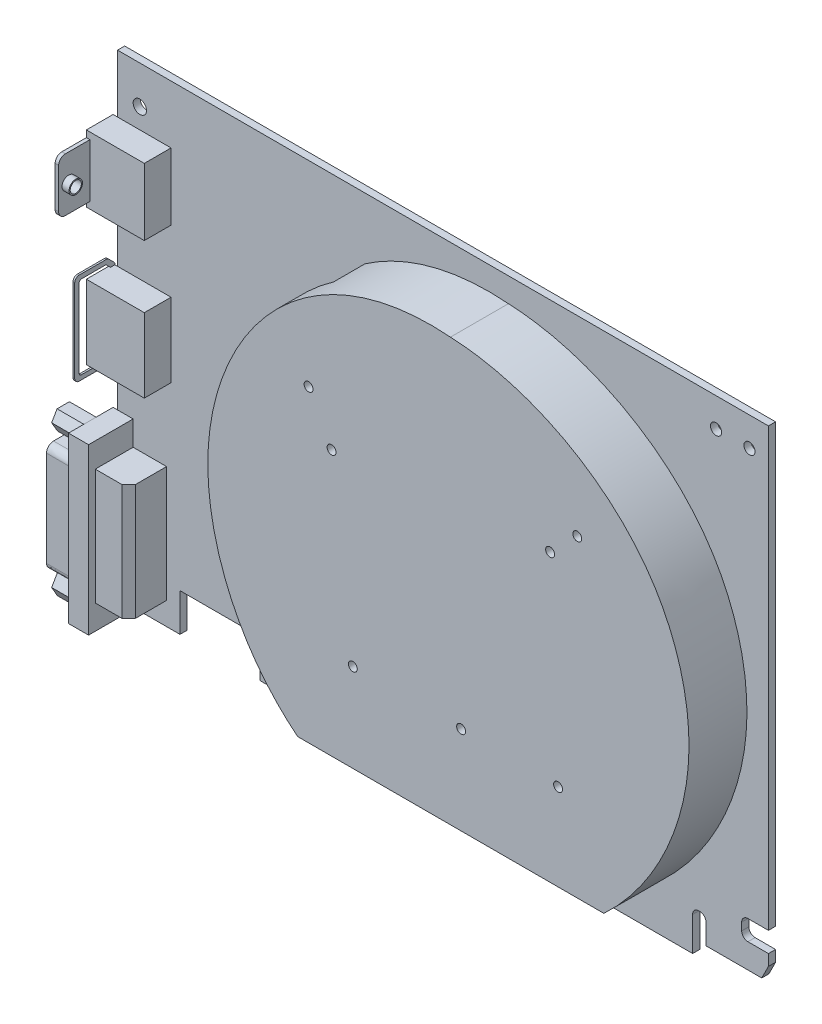
from build123d import *

# Parameters (mm, degrees)
SKETCH1_R                = 1.5
SKETCH1_R_2              = 1.25
BOSS_EXTRUDE1_DEPTH      = 1.6
SKETCH6_W                = 13
SKETCH6_H                = 15
SKETCH6_H_2              = 16.609797345
BOSS_EXTRUDE8_DEPTH      = 6
SKETCH7_R                = 1.25
BOSS_EXTRUDE9_DEPTH      = 0.79375
SKETCH8_R                = 1.5
SKETCH8_R_2              = 1.25
BOSS_EXTRUDE10_DEPTH     = 1.5875
FILLET1_R                = 0.25
BOSS_EXTRUDE11_DEPTH     = 0.396875
SKETCH10_W               = 4.5
SKETCH10_H               = 37
BOSS_EXTRUDE12_DEPTH     = 10
SKETCH11_W               = 7.5
SKETCH11_H               = 26
BOSS_EXTRUDE13_DEPTH     = 8.5
CHAMFER1_SIZE            = 1.5
BOSS_EXTRUDE14_OUTLINE_R = 1.5
BOSS_EXTRUDE14_DEPTH     = 6
SKETCH3_R                = 2
BOSS_EXTRUDE3_DEPTH      = 3.5
BOSS_EXTRUDE15_DEPTH     = 13
SKETCH15_W               = 22.221546386
SKETCH15_H               = 7
CUT_EXTRUDE1_DEPTH       = 136.345566138
CUT_EXTRUDE2_REACH       = 147.937
SKETCH16_R               = 1


# Read off the part's stored shape, not the designer's step: Boss-Extrude14
with BuildPart() as part:
    # Sketch1 → Boss-Extrude1 (new body)
    with BuildSketch(Plane.XY):
        with BuildLine():
            Line((60, 13), (60, 111))
            Line((60, 111), (-86, 111))
            Line((-86, 111), (-86, 4.5))
            Line((-86, 4.5), (-72, 4.5))
            Line((-72, 4.5), (-72, 13))
            Line((-72, 13), (-54, 13))
            Line((-54, 13), (-54, 4.5))
            Line((-54, 4.5), (-46.5, 4.5))
            Line((-46.5, 4.5), (-46.5, 11.3))
            ThreePointArc((-46.5, 11.3), (-46.002081528, 12.502081528), (-44.8, 13))
            Line((-44.8, 13), (-44.7, 13))
            ThreePointArc((-44.7, 13), (-43.497918472, 12.502081528), (-43, 11.3))
            Line((-43, 11.3), (-43, 0))
            Line((-43, 0), (-31.5, 0))
            Line((-31.5, 0), (-31.5, 7.6))
            ThreePointArc((-31.5, 7.6), (-31.089949494, 8.589949494), (-30.1, 9))
            Line((-30.1, 9), (-29.9, 9))
            ThreePointArc((-29.9, 9), (-28.910050506, 8.589949494), (-28.5, 7.6))
            Line((-28.5, 7.6), (-28.5, 0))
            Line((-28.5, 0), (43, 0))
            Line((43, 0), (43, 7.6))
            ThreePointArc((43, 7.6), (43.410050506, 8.589949494), (44.4, 9))
            Line((44.4, 9), (44.6, 9))
            ThreePointArc((44.6, 9), (45.589949494, 8.589949494), (46, 7.6))
            Line((46, 7.6), (46, 3))
            Line((46, 3), (58.5, 3))
            Line((58.5, 3), (60, 6))
            Line((60, 6), (60, 8.5))
            Line((60, 8.5), (55.4, 8.5))
            ThreePointArc((55.4, 8.5), (54.410050506, 8.910050506), (54, 9.9))
            Line((54, 9.9), (54, 11.6))
            ThreePointArc((54, 11.6), (54.410050506, 12.589949494), (55.4, 13))
            Line((55.4, 13), (60, 13))
        make_face()
        with Locations((-81, 102.5)):
            Circle(SKETCH1_R, mode=Mode.SUBTRACT)
        with Locations((48.25, 104.5)):
            Circle(SKETCH1_R_2, mode=Mode.SUBTRACT)
        with Locations((55.75, 104.5)):
            Circle(SKETCH1_R_2, mode=Mode.SUBTRACT)
    extrude(amount=BOSS_EXTRUDE1_DEPTH)

    # Sketch6 → Boss-Extrude8 (add)
    with BuildSketch(Plane.XY.offset(1.6)):
        with Locations((-80.5, 90.5)):
            Rectangle(SKETCH6_W, SKETCH6_H)
        with Locations((-80.5, 60.695101327)):
            Rectangle(SKETCH6_W, SKETCH6_H_2)
    extrude(amount=BOSS_EXTRUDE8_DEPTH)

    # Sketch7 → Boss-Extrude9 (add)
    with BuildSketch(Plane.ZY.offset(87)):
        with BuildLine():
            Line((7.6, 96.5), (13.1, 96.5))
            ThreePointArc((13.1, 96.5), (14.160660172, 96.060660172), (14.6, 95))
            Line((14.6, 95), (14.6, 86))
            ThreePointArc((14.6, 86), (14.160660172, 84.939339828), (13.1, 84.5))
            Line((13.1, 84.5), (7.6, 84.5))
            Line((7.6, 84.5), (7.6, 96.5))
        make_face()
        with Locations((12.35, 90.5)):
            Circle(SKETCH7_R, mode=Mode.SUBTRACT)
    extrude(amount=-BOSS_EXTRUDE9_DEPTH)

    # Sketch8 → Boss-Extrude10 (add)
    with BuildSketch(Plane(origin=(-86.20625, 0, 0), x_dir=(0, 0, -1), z_dir=(1, 0, 0))):
        with Locations(Location((-12.35, 90.5, 0), (0, 0, 180))):
            Circle(SKETCH8_R)
        with Locations(Location((-12.35, 90.5, 0), (0, 0, 180))):
            Circle(SKETCH8_R_2, mode=Mode.SUBTRACT)
    extrude(amount=BOSS_EXTRUDE10_DEPTH)

    # Fillet1
    fillet1_edges = [part.edges().sort_by_distance(p)[0] for p in [
        (-87, 90.5, 11.1),
    ]]
    fillet(fillet1_edges, radius=FILLET1_R)



with BuildPart() as body_2:
    # Sketch9 → Boss-Extrude11 (new body)
    with BuildSketch(Plane.ZY.offset(87)):
        with BuildLine():
            Line((1.6, 69), (2.6, 69))
            Line((2.6, 69), (3.453553391, 69.853553391))
            ThreePointArc((3.453553391, 69.853553391), (3.615765065, 69.961939766), (3.807106781, 70))
            Line((3.807106781, 70), (9.1, 70))
            ThreePointArc((9.1, 70), (9.453553391, 69.853553391), (9.6, 69.5))
            Line((9.6, 69.5), (9.6, 51.890202655))
            ThreePointArc((9.6, 51.890202655), (9.453553391, 51.536649264), (9.1, 51.390202655))
            Line((9.1, 51.390202655), (3.1, 51.390202655))
            ThreePointArc((3.1, 51.390202655), (2.746446609, 51.536649264), (2.6, 51.890202655))
            Line((2.6, 51.890202655), (2.6, 52.390202655))
            Line((2.6, 52.390202655), (1.6, 52.390202655))
            Line((1.6, 52.390202655), (1.6, 51.390202655))
            ThreePointArc((1.6, 51.390202655), (1.892893219, 50.683095874), (2.6, 50.390202655))
            Line((2.6, 50.390202655), (9.6, 50.390202655))
            ThreePointArc((9.6, 50.390202655), (10.307106781, 50.683095874), (10.6, 51.390202655))
            Line((10.6, 51.390202655), (10.6, 70))
            ThreePointArc((10.6, 70), (10.307106781, 70.707106781), (9.6, 71))
            Line((9.6, 71), (3.6, 71))
            ThreePointArc((3.6, 71), (3.217316568, 70.923879533), (2.892893219, 70.707106781))
            Line((2.892893219, 70.707106781), (1.746446609, 69.560660172))
            ThreePointArc((1.746446609, 69.560660172), (1.638060234, 69.398448497), (1.6, 69.207106781))
            Line((1.6, 69.207106781), (1.6, 69))
        make_face()
    extrude(amount=-BOSS_EXTRUDE11_DEPTH)


with BuildPart() as body_3:
    # Sketch10 → Boss-Extrude12 (new body)
    with BuildSketch(Plane.XY.offset(1.6)):
        with Locations((-84.75, 22.603125)):
            Rectangle(SKETCH10_W, SKETCH10_H)
    extrude(amount=BOSS_EXTRUDE12_DEPTH)


with BuildPart() as part_1:
    add(part.part)

    add(body_3.part)  # Boss-Extrude13 merges body 3
    # Sketch11 → Boss-Extrude13 (add)
    with BuildSketch(Plane.XY.offset(1.6)):
        with Locations((-78.75, 22.603125)):
            Rectangle(SKETCH11_W, SKETCH11_H)
    extrude(amount=BOSS_EXTRUDE13_DEPTH)

    # Chamfer1
    chamfer1_edges = [part_1.edges().sort_by_distance(p)[0] for p in [
        (-75, 22.603125, 10.1),
    ]]
    chamfer(chamfer1_edges, length=CHAMFER1_SIZE)

    # Sketch3 → Boss-Extrude3 (add)
    with BuildSketch(Plane.XY.offset(1.6)):
        with Locations(Location((28.962460054, 77.002904557, 0), (0, 0, 180))):
            Circle(SKETCH3_R)
        with Locations(Location((-15.207880248, 33.558155061, 0), (0, 0, 180))):
            Circle(SKETCH3_R)
        with Locations(Location((-15.207880248, 77.002904557, 0), (0, 0, 180))):
            Circle(SKETCH3_R)
        with Locations(Location((28.962460054, 33.558155061, 0), (0, 0, 180))):
            Circle(SKETCH3_R)
    extrude(amount=BOSS_EXTRUDE3_DEPTH)

    # Sketch14 → Boss-Extrude15 (add)
    with BuildSketch(Plane.XY.offset(5.1)):
        with BuildLine():
            Line((39.58334747, 14.346949086), (-29.080859027, 14.346949086))
            add(Edge.make_bspline(
                [(-29.080859027, 14.346949086), (-42.030418599, 24.63677564), (-61.87455622, 69.273049621), (-27.239904132, 111.654610086), (5.175455914, 109.082333326)],
                knots=[0, 0, 0, 0, 0.382523958, 1, 1, 1, 1], degree=3))
            add(Edge.make_bspline(
                [(5.175455914, 109.082333326), (23.032981134, 108.288544633), (50.908116549, 93.84660427), (63.154638356, 49.85058739), (51.114415198, 25.045321858), (39.58334747, 14.346949086)],
                knots=[0, 0, 0, 0, 0.418949165, 0.633527097, 1, 1, 1, 1], degree=3))
        make_face()
    extrude(amount=BOSS_EXTRUDE15_DEPTH)

    # Sketch15 → Cut-Extrude1 (cut, through all)
    with BuildSketch(Plane.XZ.offset(-14.346949086)):
        with Locations((-38.143449242, 8.6)):
            Rectangle(SKETCH15_W, SKETCH15_H)
    extrude(amount=-CUT_EXTRUDE1_DEPTH, mode=Mode.SUBTRACT)

    # Cut-Extrude2: up to this face of the body (flat: up to its plane)
    cut_extrude2_end = Plane(part_1.part.faces().sort_by_distance((12.243336315, 59.494417949, 5.1))[0])
    # Sketch16 → Cut-Extrude2 (cut, up to the picked face)
    with BuildSketch(Plane.XY.offset(18.1), mode=Mode.PRIVATE) as cut_extrude2_sk1:
        with Locations((-16.722982155, 34.14832848)):
            Circle(SKETCH16_R)
    cut_extrude2_tool1 = split(extrude(cut_extrude2_sk1.sketch, amount=-CUT_EXTRUDE2_REACH, mode=Mode.PRIVATE), bisect_by=cut_extrude2_end, keep=Keep.BOTH, mode=Mode.PRIVATE)
    # Sketch16 → Cut-Extrude2 (cut, up to the picked face)
    with BuildSketch(Plane.XY.offset(18.1), mode=Mode.PRIVATE) as cut_extrude2_sk2:
        with Locations((7.563059583, 34.14832848)):
            Circle(SKETCH16_R)
    cut_extrude2_tool2 = split(extrude(cut_extrude2_sk2.sketch, amount=-CUT_EXTRUDE2_REACH, mode=Mode.PRIVATE), bisect_by=cut_extrude2_end, keep=Keep.BOTH, mode=Mode.PRIVATE)
    # Sketch16 → Cut-Extrude2 (cut, up to the picked face)
    with BuildSketch(Plane.XY.offset(18.1), mode=Mode.PRIVATE) as cut_extrude2_sk3:
        with Locations((29.319351945, 33.793299212)):
            Circle(SKETCH16_R)
    cut_extrude2_tool3 = split(extrude(cut_extrude2_sk3.sketch, amount=-CUT_EXTRUDE2_REACH, mode=Mode.PRIVATE), bisect_by=cut_extrude2_end, keep=Keep.BOTH, mode=Mode.PRIVATE)
    # Sketch16 → Cut-Extrude2 (cut, up to the picked face)
    with BuildSketch(Plane.XY.offset(18.1), mode=Mode.PRIVATE) as cut_extrude2_sk4:
        with Locations((33.62020254, 84.613976648)):
            Circle(SKETCH16_R)
    cut_extrude2_tool4 = split(extrude(cut_extrude2_sk4.sketch, amount=-CUT_EXTRUDE2_REACH, mode=Mode.PRIVATE), bisect_by=cut_extrude2_end, keep=Keep.BOTH, mode=Mode.PRIVATE)
    # Sketch16 → Cut-Extrude2 (cut, up to the picked face)
    with BuildSketch(Plane.XY.offset(18.1), mode=Mode.PRIVATE) as cut_extrude2_sk5:
        with Locations((27.528474336, 78.511370358)):
            Circle(SKETCH16_R)
    cut_extrude2_tool5 = split(extrude(cut_extrude2_sk5.sketch, amount=-CUT_EXTRUDE2_REACH, mode=Mode.PRIVATE), bisect_by=cut_extrude2_end, keep=Keep.BOTH, mode=Mode.PRIVATE)
    # Sketch16 → Cut-Extrude2 (cut, up to the picked face)
    with BuildSketch(Plane.XY.offset(18.1), mode=Mode.PRIVATE) as cut_extrude2_sk6:
        with Locations((-26.65262878, 83.525950742)):
            Circle(SKETCH16_R)
    cut_extrude2_tool6 = split(extrude(cut_extrude2_sk6.sketch, amount=-CUT_EXTRUDE2_REACH, mode=Mode.PRIVATE), bisect_by=cut_extrude2_end, keep=Keep.BOTH, mode=Mode.PRIVATE)
    # Sketch16 → Cut-Extrude2 (cut, up to the picked face)
    with BuildSketch(Plane.XY.offset(18.1), mode=Mode.PRIVATE) as cut_extrude2_sk7:
        with Locations((-21.489260834, 73.865364382)):
            Circle(SKETCH16_R)
    cut_extrude2_tool7 = split(extrude(cut_extrude2_sk7.sketch, amount=-CUT_EXTRUDE2_REACH, mode=Mode.PRIVATE), bisect_by=cut_extrude2_end, keep=Keep.BOTH, mode=Mode.PRIVATE)
    add(cut_extrude2_tool1.solids().sort_by(Axis((-16.722982, 34.148328, 18.1), (0, 0, -1)))[0], mode=Mode.SUBTRACT)
    add(cut_extrude2_tool2.solids().sort_by(Axis((7.56306, 34.148328, 18.1), (0, 0, -1)))[0], mode=Mode.SUBTRACT)
    add(cut_extrude2_tool3.solids().sort_by(Axis((29.319352, 33.793299, 18.1), (0, 0, -1)))[0], mode=Mode.SUBTRACT)
    add(cut_extrude2_tool4.solids().sort_by(Axis((33.620203, 84.613977, 18.1), (0, 0, -1)))[0], mode=Mode.SUBTRACT)
    add(cut_extrude2_tool5.solids().sort_by(Axis((27.528474, 78.51137, 18.1), (0, 0, -1)))[0], mode=Mode.SUBTRACT)
    add(cut_extrude2_tool6.solids().sort_by(Axis((-26.652629, 83.525951, 18.1), (0, 0, -1)))[0], mode=Mode.SUBTRACT)
    add(cut_extrude2_tool7.solids().sort_by(Axis((-21.489261, 73.865364, 18.1), (0, 0, -1)))[0], mode=Mode.SUBTRACT)


with BuildPart() as body_3_2:
    # Boss-Extrude14 outline → Boss-Extrude14 (new body)
    # profile 1 of 3: a face of its own
    with BuildSketch(Plane.ZY.offset(87)):
        with BuildLine():
            Line((5.942098374, 10.726920302), (8.955979514, 10.726920302))
            add(Edge.make_bspline(
                [(8.955979514, 10.726920302), (9.922531667, 10.726920302), (10.549713325, 11.599062815), (10.549713325, 12.286721117)],
                knots=[0, 0, 0, 0, 1, 1, 1, 1], degree=3))
            Line((10.549713325, 12.286721117), (10.549713325, 33.687493147))
            add(Edge.make_bspline(
                [(8.955979514, 35.247293962), (9.922531667, 35.247293962), (10.549713325, 34.375151449), (10.549713325, 33.687493147)],
                knots=[0, 0, 0, 0, 1, 1, 1, 1], degree=3))
            Line((8.955979514, 35.247293962), (5.942098374, 35.247293962))
            add(Edge.make_bspline(
                [(5.942098374, 35.247293962), (4.797011588, 35.247293962), (2.904707306, 34.584070575), (2.904707306, 32.957206225)],
                knots=[0, 0, 0, 0, 1, 1, 1, 1], degree=3))
            Line((2.904707306, 32.957206225), (2.904707306, 13.017008039))
            add(Edge.make_bspline(
                [(5.942098374, 10.726920302), (4.797011588, 10.726920302), (2.904707306, 11.390143689), (2.904707306, 13.017008039)],
                knots=[0, 0, 0, 0, 1, 1, 1, 1], degree=3))
        make_face()
    # profile 2 of 3: a face of its own
    with BuildSketch(Plane.ZY.offset(87)):
        Polygon((5.485414268, 4.749769624), (8.083490479, 4.749769624), (9.382528585, 6.999769624), (8.083490479, 9.249769624), (5.485414268, 9.249769624), (4.186376162, 6.999769624), align=None)
        with Locations((6.784452374, 6.999769624)):
            Circle(BOSS_EXTRUDE14_OUTLINE_R, mode=Mode.SUBTRACT)
    # profile 3 of 3: a face of its own
    with BuildSketch(Plane.ZY.offset(87)):
        Polygon((5.485414268, 36.750230376), (8.083490479, 36.750230376), (9.382528585, 39.000230376), (8.168421808, 41.103125), (5.400482939, 41.103125), (4.186376162, 39.000230376), align=None)
        with Locations((6.784452374, 39.000230376)):
            Circle(BOSS_EXTRUDE14_OUTLINE_R, mode=Mode.SUBTRACT)
    extrude(amount=BOSS_EXTRUDE14_DEPTH)


solid = Compound([body_2.part, part_1.part, body_3_2.part])
